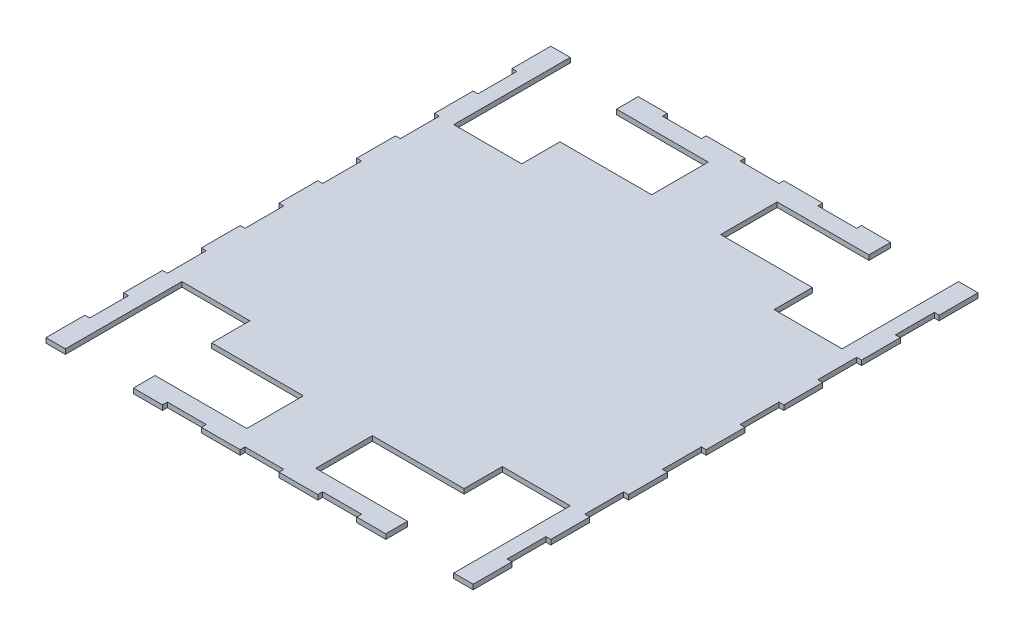
from build123d import *

# Parameters (mm, degrees)
BOSS_EXTRUDE1_DEPTH     = 3.175
CUT_EXTRUDE1_DEPTH      = 217.296510894
CUT_EXTRUDE1_DEPTH_BACK = 217.296510894
SKETCH3_W               = 60
SKETCH3_H               = 37
MIRROR1_DEPTH           = 3.175


# Read off the part's stored shape, not the designer's step: Mirror1
with BuildPart() as part:
    # Sketch1 → Boss-Extrude1 (new body)
    with BuildSketch(Plane(origin=(0, 0, 0), x_dir=(1, 0, 0), z_dir=(0, 1, 0))):
        Polygon((-139.7, 0), (0, 0), (0, 161.925), (-12.7, 161.925), (-12.7, 165.1), (-38.1, 165.1), (-38.1, 161.925), (-63.5, 161.925), (-63.5, 165.1), (-88.9, 165.1), (-88.9, 161.925), (-114.3, 161.925), (-114.3, 165.1), (-139.7, 165.1), (-139.7, 139.7), (-136.525, 139.7), (-136.525, 114.3), (-139.7, 114.3), (-139.7, 88.9), (-136.525, 88.9), (-136.525, 63.5), (-139.7, 63.5), (-139.7, 38.1), (-136.525, 38.1), (-136.525, 12.7), (-139.7, 12.7), align=None)
    extrude(amount=BOSS_EXTRUDE1_DEPTH)

    # Sketch3 → Cut-Extrude1 (cut, two sides: drawn at the far end of the back side and taken through both)
    with BuildSketch(Plane(origin=(0, 3.175, 0), x_dir=(1, 0, 0), z_dir=(0, 1, 0)).offset(-CUT_EXTRUDE1_DEPTH_BACK)):
        with Locations((-52.55, 132.4)):
            Rectangle(SKETCH3_W, SKETCH3_H)
        Polygon((-127, 165.1), (-127, 88.9), (-82.55, 88.9), (-82.55, 113.9), (-82.55, 150.9), (-82.55, 165.1), (-88.9, 165.1), (-88.9, 161.925), (-114.3, 161.925), (-114.3, 165.1), align=None)
    extrude(amount=CUT_EXTRUDE1_DEPTH + CUT_EXTRUDE1_DEPTH_BACK, mode=Mode.SUBTRACT)

    # Mirror1 outline → Mirror1 (add)
    with BuildSketch(Plane(origin=(0, 0, 0), x_dir=(1, 0, 0), z_dir=(0, 1, 0))):
        Polygon((139.7, 165.1), (127, 165.1), (127, 88.9), (82.55, 88.9), (82.55, 113.9), (22.55, 113.9), (22.55, 150.9), (82.55, 150.9), (82.55, 165.1), (63.5, 165.1), (63.5, 161.925), (38.1, 161.925), (38.1, 165.1), (12.7, 165.1), (12.7, 161.925), (0, 161.925), (0, 0), (-139.7, 0), (-139.7, -12.7), (-136.525, -12.7), (-136.525, -38.1), (-139.7, -38.1), (-139.7, -63.5), (-136.525, -63.5), (-136.525, -88.9), (-139.7, -88.9), (-139.7, -114.3), (-136.525, -114.3), (-136.525, -139.7), (-139.7, -139.7), (-139.7, -165.1), (-127, -165.1), (-127, -88.9), (-82.55, -88.9), (-82.55, -113.9), (-22.55, -113.9), (-22.55, -150.9), (-82.55, -150.9), (-82.55, -165.1), (-63.5, -165.1), (-63.5, -161.925), (-38.1, -161.925), (-38.1, -165.1), (-12.7, -165.1), (-12.7, -161.925), (12.7, -161.925), (12.7, -165.1), (38.1, -165.1), (38.1, -161.925), (63.5, -161.925), (63.5, -165.1), (82.55, -165.1), (82.55, -150.9), (22.55, -150.9), (22.55, -113.9), (82.55, -113.9), (82.55, -88.9), (127, -88.9), (127, -165.1), (139.7, -165.1), (139.7, -139.7), (136.525, -139.7), (136.525, -114.3), (139.7, -114.3), (139.7, -88.9), (136.525, -88.9), (136.525, -63.5), (139.7, -63.5), (139.7, -38.1), (136.525, -38.1), (136.525, -12.7), (139.7, -12.7), (139.7, 12.7), (136.525, 12.7), (136.525, 38.1), (139.7, 38.1), (139.7, 63.5), (136.525, 63.5), (136.525, 88.9), (139.7, 88.9), (139.7, 114.3), (136.525, 114.3), (136.525, 139.7), (139.7, 139.7), align=None)
    extrude(amount=MIRROR1_DEPTH)


solid = part.part
